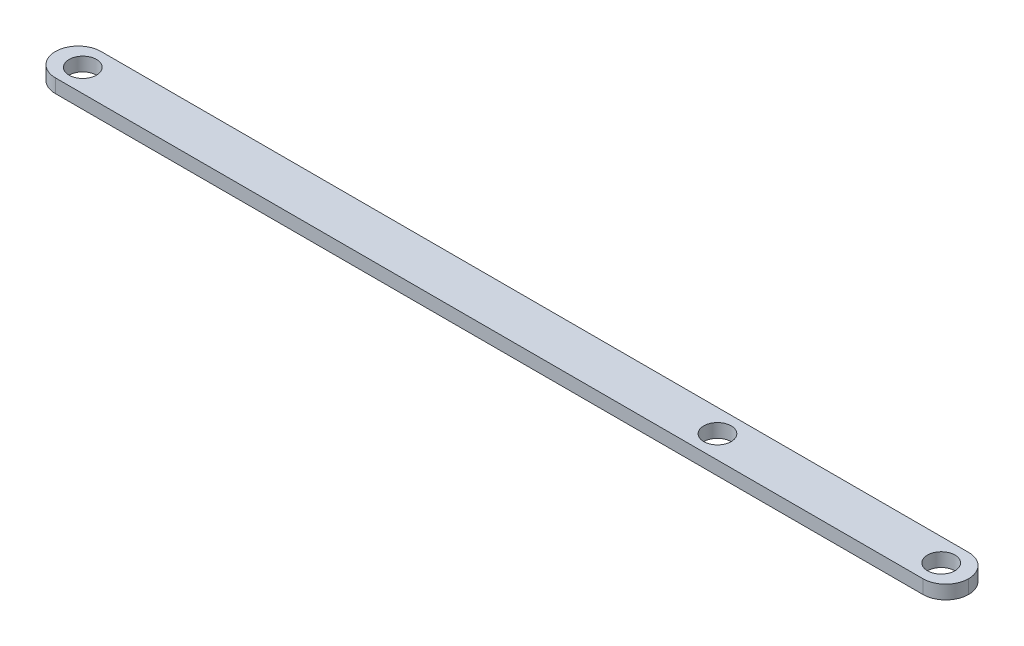
from build123d import *

# Parameters (mm, degrees)
SKETCH2_W           = 200
SKETCH2_H           = 10
BOSS_EXTRUDE1_DEPTH = 3
SKETCH3_R           = 3
CUT_EXTRUDE1_DEPTH  = 201.272314612
SKETCH4_R           = 3
CUT_EXTRUDE2_DEPTH  = 201.272314612
FILLET1_R           = 5
FILLET2_R           = 5
SKETCH5_R           = 3
CUT_EXTRUDE3_DEPTH  = 201.272314612


with BuildPart() as part:
    # Sketch2 → Boss-Extrude1 (new body)
    with BuildSketch(Plane(origin=(0, 0, 0), x_dir=(1, 0, 0), z_dir=(0, 1, 0))):
        with Locations((100, 5)):
            Rectangle(SKETCH2_W, SKETCH2_H)
    extrude(amount=BOSS_EXTRUDE1_DEPTH)

    # Sketch3 → Cut-Extrude1 (cut, through all)
    with BuildSketch(Plane(origin=(0, 3, 0), x_dir=(1, 0, 0), z_dir=(0, 1, 0))):
        with Locations(Location((6, 5, 0), (0, 0, 270))):
            Circle(SKETCH3_R)
    extrude(amount=-CUT_EXTRUDE1_DEPTH, mode=Mode.SUBTRACT)

    # Sketch4 → Cut-Extrude2 (cut, through all)
    with BuildSketch(Plane(origin=(0, 3, 0), x_dir=(1, 0, 0), z_dir=(0, 1, 0))):
        with Locations(Location((194, 5, 0), (0, 0, 270))):
            Circle(SKETCH4_R)
    extrude(amount=-CUT_EXTRUDE2_DEPTH, mode=Mode.SUBTRACT)

    # Fillet1
    fillet1_edges = [part.edges().sort_by_distance(p)[0] for p in [
        (0, 1.5, -10),
        (0, 1.5, 0),
    ]]
    fillet(fillet1_edges, radius=FILLET1_R - 0.0001)  # a hair under: the kernel refuses the full size

    # Fillet2
    fillet2_edges = [part.edges().sort_by_distance(p)[0] for p in [
        (200, 1.5, -10),
        (200, 1.5, 0),
    ]]
    fillet(fillet2_edges, radius=FILLET2_R - 0.0001)  # a hair under: the kernel refuses the full size

    # Sketch5 → Cut-Extrude3 (cut, through all)
    with BuildSketch(Plane(origin=(0, 3, 0), x_dir=(1, 0, 0), z_dir=(0, 1, 0))):
        with Locations(Location((145, 5, 0), (0, 0, 270))):
            Circle(SKETCH5_R)
    extrude(amount=-CUT_EXTRUDE3_DEPTH, mode=Mode.SUBTRACT)


solid = part.part
